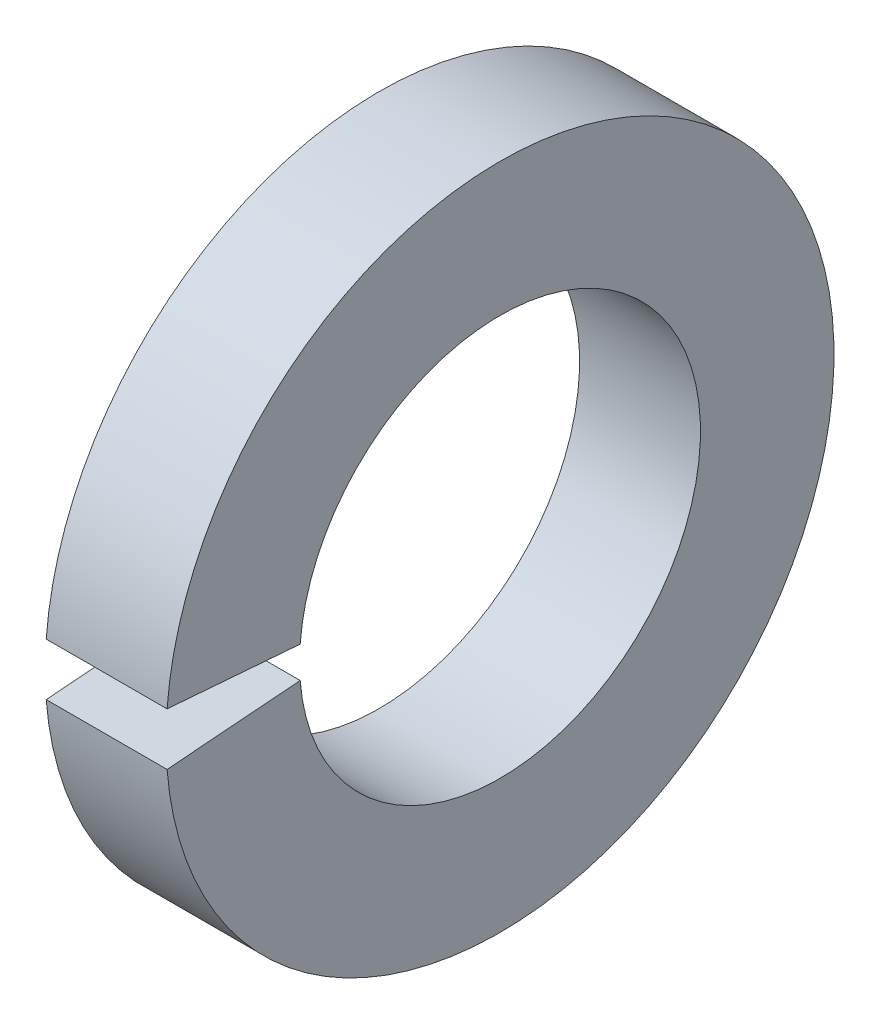
from build123d import *

# Parameters (mm, degrees)
SKETCH1_W = 7.7724
SKETCH1_H = 8.5852
GAP_DEPTH = 32.349985371


with BuildPart() as part:
    # Sketch1 → Base-Revolve (revolve)
    with BuildSketch(Plane.XY):
        with Locations((-3.8862, 17.1831)):
            Rectangle(SKETCH1_W, SKETCH1_H)
    revolve(axis=Axis((-34.925, 0, 0), (1, 0, 0)))

    # Sketch2 → Gap (cut, through all)
    with BuildSketch(Plane(origin=(0, 0, 0), x_dir=(0, -1, 0), z_dir=(-1, 0, 0))):
        with BuildLine():
            Line((0, 0), (1.718663282, 21.837687536))
            ThreePointArc((1.718663282, 21.837687536), (0, 21.905214), (-1.718663282, 21.837687536))
            Line((-1.718663282, 21.837687536), (0, 0))
        make_face()
    extrude(amount=GAP_DEPTH, mode=Mode.SUBTRACT)


solid = part.part
